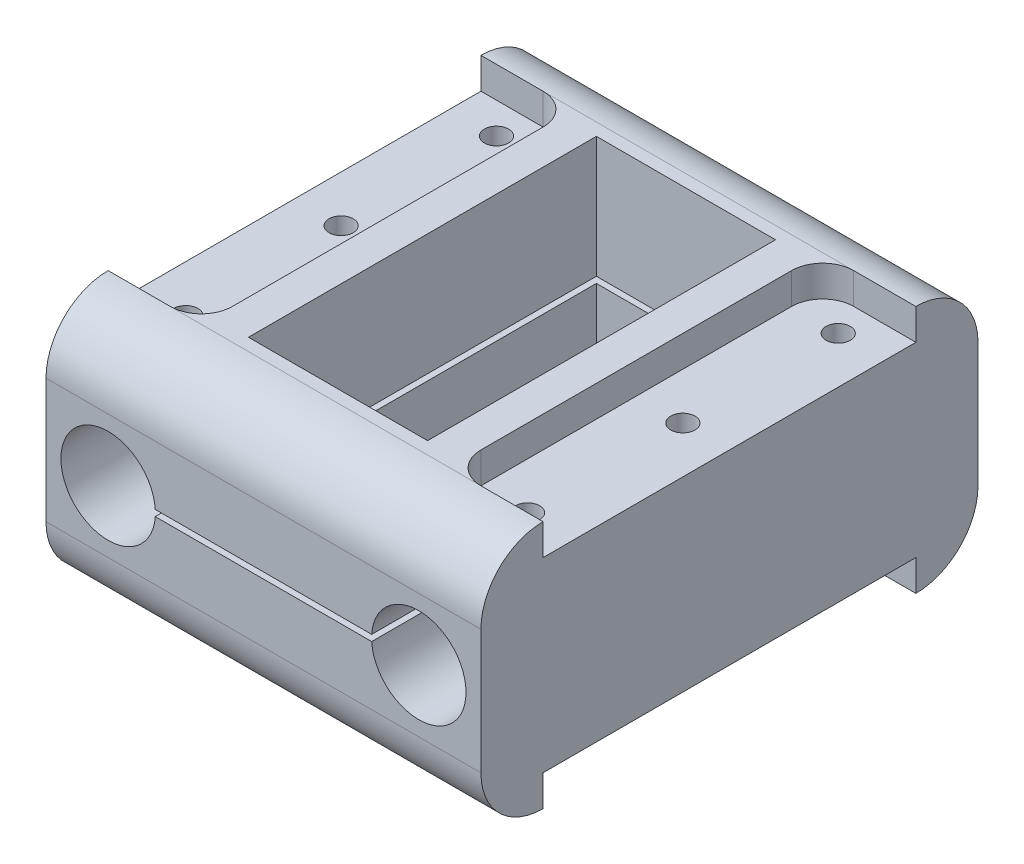
from build123d import *

# Parameters (mm, degrees)
SKETCH1_W                    = 70
SKETCH1_H                    = 40
SKETCH1_R                    = 7.6
BOSS_EXTRUDE1_DEPTH          = 80
FILLET1_R                    = 10
CUT_EXTRUDE_THIN1_DEPTH      = 102.980390272
CUT_EXTRUDE_THIN1_DEPTH_BACK = 95
CUT_EXTRUDE15_DEPTH          = 39
CUT_EXTRUDE15_DEPTH_BACK     = 40
SKETCH24_W                   = 28.832930408
SKETCH24_H                   = 56
CUT_EXTRUDE17_DEPTH          = 5
SKETCH28_R                   = 1.95
CUT_EXTRUDE18_DEPTH          = 20
MIRROR2_COPY_1_DEPTH         = 5
MIRROR2_COPY_2_SKETCH_R      = 1.95
MIRROR2_COPY_2_DEPTH         = 20
MIRROR2_COPY_3_DEPTH         = 5
MIRROR2_COPY_4_SKETCH_R      = 1.95
MIRROR2_COPY_4_DEPTH         = 20


with BuildPart() as part:
    # Sketch1 → Boss-Extrude1 (new body)
    with BuildSketch(Plane.XY):
        with Locations((25, 0)):
            Rectangle(SKETCH1_W, SKETCH1_H)
        Circle(SKETCH1_R, mode=Mode.SUBTRACT)
        with Locations((50, 0)):
            Circle(SKETCH1_R, mode=Mode.SUBTRACT)
    extrude(amount=BOSS_EXTRUDE1_DEPTH)

    # Fillet1
    fillet1_edges = [part.edges().sort_by_distance(p)[0] for p in [
        (25, 20, 80),
        (25, -20, 80),
        (25, -20, 0),
        (25, 20, 0),
    ]]
    fillet(fillet1_edges, radius=FILLET1_R)

    # Sketch12 → Cut-Extrude-Thin1 (cut, two sides: drawn at the far end of the back side and taken through both)
    with BuildSketch(Plane.XY.offset(80).offset(-CUT_EXTRUDE_THIN1_DEPTH_BACK)):
        Polygon((3.119310539, -0.5), (7.6, -0.5), (42.4, -0.5), (46.98201893, -0.5), (46.98201893, 0.5), (42.4, 0.5), (7.6, 0.5), (3.119310539, 0.5), align=None)
    extrude(amount=CUT_EXTRUDE_THIN1_DEPTH + CUT_EXTRUDE_THIN1_DEPTH_BACK, mode=Mode.SUBTRACT)

    # Sketch24 → Cut-Extrude15 (cut, two sides: drawn at the far end of the back side and taken through both)
    with BuildSketch(Plane.XZ.offset(-0.5).offset(-CUT_EXTRUDE15_DEPTH_BACK)):
        with Locations((25, 40)):
            Rectangle(SKETCH24_W, SKETCH24_H)
    extrude(amount=CUT_EXTRUDE15_DEPTH + CUT_EXTRUDE15_DEPTH_BACK, mode=Mode.SUBTRACT)

    # Sketch27 → Cut-Extrude17 (cut)
    with BuildSketch(Plane(origin=(0, 20, 0), x_dir=(1, 0, 0), z_dir=(0, 1, 0))):
        with BuildLine():
            Line((-10, -10), (0, -10))
            ThreePointArc((0, -10), (3.535533906, -11.464466094), (5, -15))
            Line((5, -15), (5, -65))
            ThreePointArc((5, -65), (3.535533906, -68.535533906), (0, -70))
            Line((0, -70), (-10, -70))
            Line((-10, -70), (-10, -10))
        make_face()
    cut_extrude17 = extrude(amount=-CUT_EXTRUDE17_DEPTH, mode=Mode.SUBTRACT)

    # Sketch28 → Cut-Extrude18 (cut)
    with BuildSketch(Plane(origin=(0, 15, 0), x_dir=(1, 0, 0), z_dir=(0, 1, 0))):
        with Locations((-2.5, -15)):
            Circle(SKETCH28_R)
        with Locations((-2.5, -40)):
            Circle(SKETCH28_R)
        with Locations((-2.5, -65)):
            Circle(SKETCH28_R)
    cut_extrude18 = extrude(amount=-CUT_EXTRUDE18_DEPTH, mode=Mode.SUBTRACT)

    # Mirror1: Cut-Extrude17, Cut-Extrude18 across plane
    add(cut_extrude17.mirror(Plane.ZY.offset(-25)), mode=Mode.SUBTRACT)
    add(cut_extrude18.mirror(Plane.ZY.offset(-25)), mode=Mode.SUBTRACT)

    # Mirror2 copy 1 sketch → Mirror2 copy 1 (cut)
    with BuildSketch(Plane(origin=(50, -20, 0), x_dir=(-1, 0, 0), z_dir=(0, -1, 0))):
        with BuildLine():
            Line((-10, -10), (0, -10))
            ThreePointArc((0, -10), (3.535533906, -11.464466094), (5, -15))
            Line((5, -15), (5, -65))
            ThreePointArc((5, -65), (3.535533906, -68.535533906), (0, -70))
            Line((0, -70), (-10, -70))
            Line((-10, -70), (-10, -10))
        make_face()
    extrude(amount=-MIRROR2_COPY_1_DEPTH, mode=Mode.SUBTRACT)

    # Mirror2 copy 2 sketch → Mirror2 copy 2 (cut)
    with BuildSketch(Plane(origin=(50, -15, 0), x_dir=(-1, 0, 0), z_dir=(0, -1, 0))):
        with Locations((-2.5, -15)):
            Circle(MIRROR2_COPY_2_SKETCH_R)
        with Locations((-2.5, -40)):
            Circle(MIRROR2_COPY_2_SKETCH_R)
        with Locations((-2.5, -65)):
            Circle(MIRROR2_COPY_2_SKETCH_R)
    extrude(amount=-MIRROR2_COPY_2_DEPTH, mode=Mode.SUBTRACT)

    # Mirror2 copy 3 sketch → Mirror2 copy 3 (cut)
    with BuildSketch(Plane.XZ.offset(20)):
        with BuildLine():
            Line((-10, 10), (0, 10))
            ThreePointArc((0, 10), (3.535533906, 11.464466094), (5, 15))
            Line((5, 15), (5, 65))
            ThreePointArc((5, 65), (3.535533906, 68.535533906), (0, 70))
            Line((0, 70), (-10, 70))
            Line((-10, 70), (-10, 10))
        make_face()
    extrude(amount=-MIRROR2_COPY_3_DEPTH, mode=Mode.SUBTRACT)

    # Mirror2 copy 4 sketch → Mirror2 copy 4 (cut)
    with BuildSketch(Plane.XZ.offset(15)):
        with Locations((-2.5, 15)):
            Circle(MIRROR2_COPY_4_SKETCH_R)
        with Locations((-2.5, 40)):
            Circle(MIRROR2_COPY_4_SKETCH_R)
        with Locations((-2.5, 65)):
            Circle(MIRROR2_COPY_4_SKETCH_R)
    extrude(amount=-MIRROR2_COPY_4_DEPTH, mode=Mode.SUBTRACT)


solid = part.part
